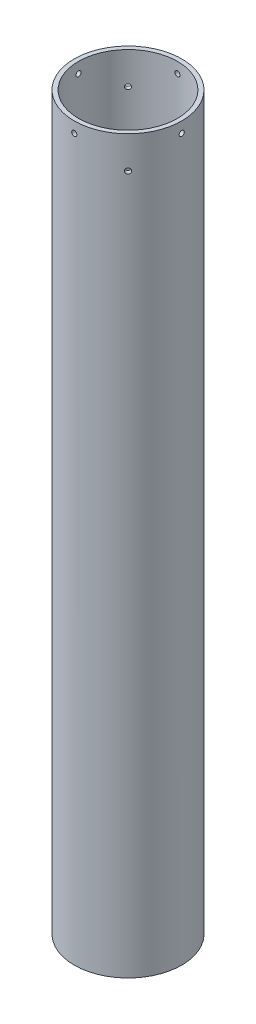
from build123d import *

# Parameters (mm, degrees)
SKETCH_1_R               = 25
SKETCH_1_R_2             = 23
EXTRUDE_1_DEPTH          = 340
SKETCH_2_R               = 1.2
CUT_EXTRUDE_1_DEPTH      = 342.833292703
PATTERN_CIRCULAR_1_COUNT = 4
SKETCH_3_R               = 1.2
CUT_EXTRUDE_2_DEPTH      = 342.833292817
PATTERN_CIRCULAR_2_COUNT = 4


with BuildPart() as part:
    # Эскиз1 → Бобышка-Вытянуть1 (new body)
    with BuildSketch(Plane(origin=(0, 0, 0), x_dir=(1, 0, 0), z_dir=(0, 1, 0))):
        Circle(SKETCH_1_R)
        Circle(SKETCH_1_R_2, mode=Mode.SUBTRACT)
    extrude(amount=EXTRUDE_1_DEPTH)

    # Эскиз2 → Вырез-Вытянуть1 (cut, through all)
    with BuildSketch(Plane(origin=(0, 0, 0), x_dir=(0, 0, -1), z_dir=(1, 0, 0))):
        with Locations((0, 335)):
            Circle(SKETCH_2_R)
    cut_extrude_1 = extrude(amount=-CUT_EXTRUDE_1_DEPTH, mode=Mode.SUBTRACT)

    # Круговой массив1: Вырез-Вытянуть1 ×4 about axis
    pattern_circular_1_axis = Axis((0, 340, 0), (0, -1, 0))
    for i in range(1, PATTERN_CIRCULAR_1_COUNT):
        add(cut_extrude_1.rotate(pattern_circular_1_axis, i * 360 / PATTERN_CIRCULAR_1_COUNT), mode=Mode.SUBTRACT)

    # Эскиз3 → Вырез-Вытянуть2 (cut, through all)
    with BuildSketch(Plane(origin=(0, 0, 0), x_dir=(0, -1, 0), z_dir=(-0.7071067811865488, 0, 0.7071067811865464))):
        with Locations((-325, 0)):
            Circle(SKETCH_3_R)
    cut_extrude_2 = extrude(amount=-CUT_EXTRUDE_2_DEPTH, mode=Mode.SUBTRACT)

    # Круговой массив2: Вырез-Вытянуть2 ×4 about axis
    pattern_circular_2_axis = Axis((0, 340, 0), (0, -1, 0))
    for i in range(1, PATTERN_CIRCULAR_2_COUNT):
        add(cut_extrude_2.rotate(pattern_circular_2_axis, i * 360 / PATTERN_CIRCULAR_2_COUNT), mode=Mode.SUBTRACT)


solid = part.part
